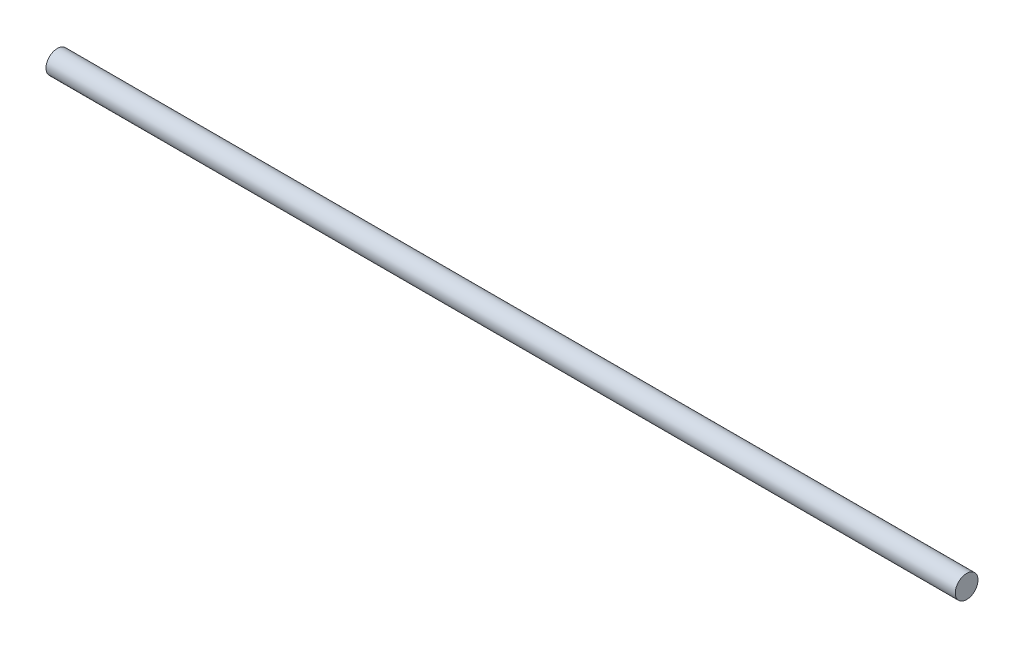
from build123d import *

# Parameters (mm, degrees)
SKETCH1_R           = 2.5
BOSS_EXTRUDE1_DEPTH = 200


with BuildPart() as part:
    # Sketch1 → Boss-Extrude1 (new body)
    with BuildSketch(Plane(origin=(0, 0, 0), x_dir=(0, 0, -1), z_dir=(1, 0, 0))):
        Circle(SKETCH1_R)
    extrude(amount=BOSS_EXTRUDE1_DEPTH)


solid = part.part
